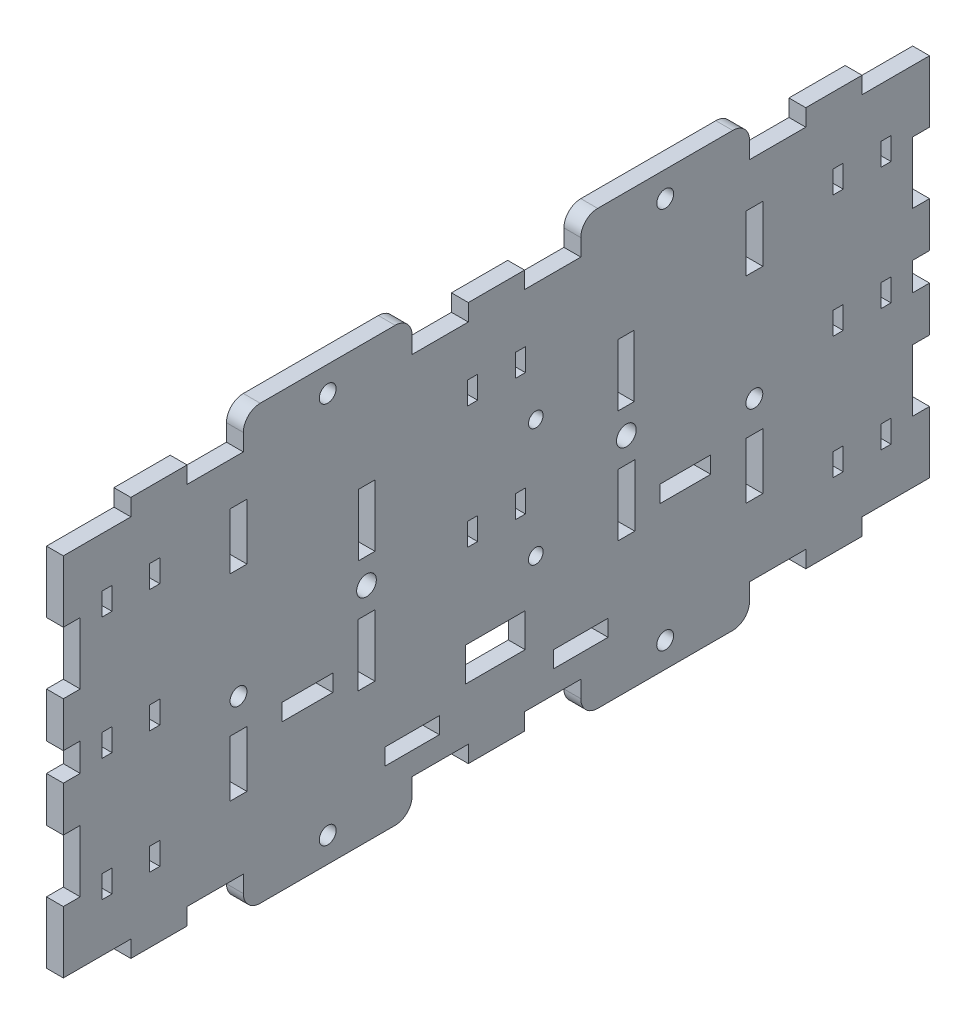
from build123d import *

# Parameters (mm, degrees)
CROQUIS1_W               = 154
CROQUIS1_H               = 71
SALIENTE_EXTRUIR1_DEPTH  = 1.5
CROQUIS2_W               = 12
CROQUIS2_H               = 3
CROQUIS2_W_2             = 10
CROQUIS2_W_3             = 3
CROQUIS2_H_2             = 11
CROQUIS2_H_3             = 5
CORTAR_EXTRUIR1_DEPTH    = 13
CROQUIS4_W               = 30
CROQUIS4_H               = 3
SALIENTE_EXTRUIR3_DEPTH  = 3
REDONDEO2_R              = 3
CROQUIS5_R               = 1.5
CORTAR_EXTRUIR2_DEPTH    = 3
REDONDEO2_OF_SIMETR_A4_R = 3
SIMETR_A5_START          = -1.5
SIMETR_A5_OUTLINE_R      = 1.5
SIMETR_A5_DEPTH          = 3
SIMETR_A5_2_DEPTH        = 3
CROQUIS6_W               = 3
CROQUIS6_H               = 10
CROQUIS6_W_2             = 9.7
CROQUIS6_H_2             = 2.94
CROQUIS6_W_3             = 10.628979849
CROQUIS6_H_3             = 6
CORTAR_EXTRUIR3_DEPTH    = 10
CROQUIS7_R               = 1.5
CORTAR_EXTRUIR4_DEPTH    = 10
CROQUIS8_W               = 9
CROQUIS8_H               = 3
CORTAR_EXTRUIR5_DEPTH    = 10
CROQUIS9_W               = 2.8
CROQUIS9_H               = 14.9
CORTAR_EXTRUIR6_DEPTH    = 10
CROQUIS10_W              = 1.8
CROQUIS10_H              = 4
CORTAR_EXTRUIR7_DEPTH    = 10
CROQUIS11_R              = 1.3
CROQUIS11_R_2            = 1.310434607
CORTAR_EXTRUIR8_DEPTH    = 10
CROQUIS12_W              = 2.9
CROQUIS12_H              = 11
CROQUIS12_W_2            = 3
CORTAR_EXTRUIR9_DEPTH    = 10
CROQUIS13_W              = 3
CROQUIS13_H              = 9
SALIENTE_EXTRUIR4_DEPTH  = 3
CROQUIS14_R              = 1.75
CORTAR_EXTRUIR10_DEPTH   = 3


# Read off the part's stored shape, not the designer's step: Simetría5
with BuildPart() as part:
    # Croquis1 → Saliente-Extruir1 (new, symmetric)
    with BuildSketch(Plane(origin=(0, 0, 0), x_dir=(0, 0, -1), z_dir=(1, 0, 0))):
        Rectangle(CROQUIS1_W, CROQUIS1_H)
    extrude(amount=SALIENTE_EXTRUIR1_DEPTH, both=True)

    # Croquis2 → Cortar-Extruir1 (cut)
    with BuildSketch(Plane(origin=(1.5, 0, 0), x_dir=(0, 0, -1), z_dir=(1, 0, 0))):
        with Locations((-71, 34)):
            Rectangle(CROQUIS2_W, CROQUIS2_H)
        with Locations((-50, 34)):
            Rectangle(CROQUIS2_W_2, CROQUIS2_H)
        with Locations((-10, 34)):
            Rectangle(CROQUIS2_W_2, CROQUIS2_H)
        with Locations((10, 34)):
            Rectangle(CROQUIS2_W_2, CROQUIS2_H)
        with Locations((50, 34)):
            Rectangle(CROQUIS2_W_2, CROQUIS2_H)
        with Locations((71, 34)):
            Rectangle(CROQUIS2_W, CROQUIS2_H)
        with Locations((50, -34)):
            Rectangle(CROQUIS2_W_2, CROQUIS2_H)
        with Locations((10, -34)):
            Rectangle(CROQUIS2_W_2, CROQUIS2_H)
        with Locations((-10, -34)):
            Rectangle(CROQUIS2_W_2, CROQUIS2_H)
        with Locations((-50, -34)):
            Rectangle(CROQUIS2_W_2, CROQUIS2_H)
        with Locations((-71, -34)):
            Rectangle(CROQUIS2_W, CROQUIS2_H)
        with Locations((71, -34)):
            Rectangle(CROQUIS2_W, CROQUIS2_H)
        with Locations((-75.5, -16)):
            Rectangle(CROQUIS2_W_3, CROQUIS2_H_2)
        with Locations((-75.5, 0)):
            Rectangle(CROQUIS2_W_3, CROQUIS2_H_3)
        with Locations((-75.5, 16)):
            Rectangle(CROQUIS2_W_3, CROQUIS2_H_2)
        with Locations((75.5, -16)):
            Rectangle(CROQUIS2_W_3, CROQUIS2_H_2)
        with Locations((75.5, 16)):
            Rectangle(CROQUIS2_W_3, CROQUIS2_H_2)
        with Locations((75.5, 0)):
            Rectangle(CROQUIS2_W_3, CROQUIS2_H_3)
    extrude(amount=-CORTAR_EXTRUIR1_DEPTH, mode=Mode.SUBTRACT)

    # Croquis4 → Saliente-Extruir3 (add)
    with BuildSketch(Plane(origin=(1.5, 0, 0), x_dir=(0, 0, -1), z_dir=(1, 0, 0))):
        with Locations((-30, 37)):
            Rectangle(CROQUIS4_W, CROQUIS4_H)
    saliente_extruir3 = extrude(amount=-SALIENTE_EXTRUIR3_DEPTH)

    # Redondeo2
    redondeo2_edges = [part.edges().sort_by_distance(p)[0] for p in [
        (0, 38.5, 45),
        (0, 38.5, 15),
    ]]
    fillet(redondeo2_edges, radius=REDONDEO2_R)

    # Croquis5 → Cortar-Extruir2 (cut)
    with BuildSketch(Plane(origin=(1.5, 0, 0), x_dir=(0, 0, -1), z_dir=(1, 0, 0))):
        with Locations((-30, 34)):
            Circle(CROQUIS5_R)
    cortar_extruir2 = extrude(amount=-CORTAR_EXTRUIR2_DEPTH, mode=Mode.SUBTRACT)

    # Simetría4: Saliente-Extruir3, Cortar-Extruir2 across plane
    add(saliente_extruir3.mirror(Plane.ZX))
    add(cortar_extruir2.mirror(Plane.ZX), mode=Mode.SUBTRACT)

    # Redondeo2 of Simetría4
    redondeo2_of_simetr_a4_edges = [part.edges().sort_by_distance(p)[0] for p in [
        (0, -38.5, 45),
        (0, -38.5, 15),
    ]]
    fillet(redondeo2_of_simetr_a4_edges, radius=REDONDEO2_OF_SIMETR_A4_R)

    # Simetría5 outline → Simetría5 (cut)
    with BuildSketch(Plane.YZ.offset(SIMETR_A5_START)):
        with Locations((34, -30)):
            Circle(SIMETR_A5_OUTLINE_R)
        with Locations((-34, -30)):
            Circle(SIMETR_A5_OUTLINE_R)
    extrude(amount=SIMETR_A5_DEPTH, mode=Mode.SUBTRACT)

    # Simetr_a5 2 outline → Simetr_a5 2 (add)
    with BuildSketch(Plane.YZ.offset(SIMETR_A5_START)):
        with BuildLine():
            Line((38.5, -42), (38.5, -18))
            ThreePointArc((38.5, -18), (37.621320344, -15.878679656), (35.5, -15))
            Line((35.5, -15), (35.5, -45))
            ThreePointArc((35.5, -45), (37.621320344, -44.121320344), (38.5, -42))
        make_face()
        with BuildLine():
            ThreePointArc((-35.5, -15), (-37.621320344, -15.878679656), (-38.5, -18))
            Line((-38.5, -18), (-38.5, -42))
            ThreePointArc((-38.5, -42), (-37.621320344, -44.121320344), (-35.5, -45))
            Line((-35.5, -45), (-35.5, -15))
        make_face()
    extrude(amount=SIMETR_A5_2_DEPTH)

    # Croquis6 → Cortar-Extruir3 (cut)
    with BuildSketch(Plane.ZY.offset(1.5)):
        with Locations((45.853003866, -15.094545578)):
            Rectangle(CROQUIS6_W, CROQUIS6_H)
        with Locations((45.853003866, 19.905454422)):
            Rectangle(CROQUIS6_W, CROQUIS6_H)
        with Locations((-45.853003866, -15.094545578)):
            Rectangle(CROQUIS6_W, CROQUIS6_H)
        with Locations((-45.853003866, 19.905454422)):
            Rectangle(CROQUIS6_W, CROQUIS6_H)
        with Locations((15, -27)):
            Rectangle(CROQUIS6_W_2, CROQUIS6_H_2)
        with Locations((-15, -27)):
            Rectangle(CROQUIS6_W_2, CROQUIS6_H_2)
        with Locations((0.209178282, -20)):
            Rectangle(CROQUIS6_W_3, CROQUIS6_H_3)
    extrude(amount=-CORTAR_EXTRUIR3_DEPTH, mode=Mode.SUBTRACT)

    # Croquis7 → Cortar-Extruir4 (cut)
    with BuildSketch(Plane(origin=(1.5, 0, 0), x_dir=(0, 0, -1), z_dir=(1, 0, 0))):
        with Locations((-45.853003866, -4.694545578)):
            Circle(CROQUIS7_R)
        with Locations(Location((45.853003866, -4.694545578, 0), (0, 0, 180))):
            Circle(CROQUIS7_R)
    extrude(amount=-CORTAR_EXTRUIR4_DEPTH, mode=Mode.SUBTRACT)

    # Croquis8 → Cortar-Extruir5 (cut)
    with BuildSketch(Plane.ZY.offset(1.5)):
        with Locations((-33.6, -11)):
            Rectangle(CROQUIS8_W, CROQUIS8_H)
        with Locations((33.6, -11)):
            Rectangle(CROQUIS8_W, CROQUIS8_H)
    extrude(amount=-CORTAR_EXTRUIR5_DEPTH, mode=Mode.SUBTRACT)

    # Croquis9 → Cortar-Extruir6 (cut)
    with BuildSketch(Plane.ZY.offset(1.5)):
        with Locations((-23.1, 1)):
            Rectangle(CROQUIS9_W, CROQUIS9_H)
        with Locations((23.1, 1)):
            Rectangle(CROQUIS9_W, CROQUIS9_H)
    extrude(amount=-CORTAR_EXTRUIR6_DEPTH, mode=Mode.SUBTRACT)

    # Croquis10 → Cortar-Extruir7 (cut)
    with BuildSketch(Plane.ZY.offset(1.5)):
        with Locations((-69.25, 21.635)):
            Rectangle(CROQUIS10_W, CROQUIS10_H)
        with Locations((-60.75, 21.635)):
            Rectangle(CROQUIS10_W, CROQUIS10_H)
        with Locations((-69.25, -0.125)):
            Rectangle(CROQUIS10_W, CROQUIS10_H)
        with Locations((-60.75, -0.125)):
            Rectangle(CROQUIS10_W, CROQUIS10_H)
        with Locations((-60.75, -21.885)):
            Rectangle(CROQUIS10_W, CROQUIS10_H)
        with Locations((-69.25, -21.885)):
            Rectangle(CROQUIS10_W, CROQUIS10_H)
        with Locations((-4.25, 21.635)):
            Rectangle(CROQUIS10_W, CROQUIS10_H)
        with Locations((4.25, 21.635)):
            Rectangle(CROQUIS10_W, CROQUIS10_H)
        with Locations((-4.25, -0.125)):
            Rectangle(CROQUIS10_W, CROQUIS10_H)
        with Locations((4.25, -0.125)):
            Rectangle(CROQUIS10_W, CROQUIS10_H)
        with Locations((69.25, -21.885)):
            Rectangle(CROQUIS10_W, CROQUIS10_H)
        with Locations((60.75, -21.885)):
            Rectangle(CROQUIS10_W, CROQUIS10_H)
        with Locations((60.75, -0.125)):
            Rectangle(CROQUIS10_W, CROQUIS10_H)
        with Locations((69.25, -0.125)):
            Rectangle(CROQUIS10_W, CROQUIS10_H)
        with Locations((60.75, 21.635)):
            Rectangle(CROQUIS10_W, CROQUIS10_H)
        with Locations((69.25, 21.635)):
            Rectangle(CROQUIS10_W, CROQUIS10_H)
    extrude(amount=-CORTAR_EXTRUIR7_DEPTH, mode=Mode.SUBTRACT)

    # Croquis11 → Cortar-Extruir8 (cut)
    with BuildSketch(Plane(origin=(1.5, 0, 0), x_dir=(0, 0, -1), z_dir=(1, 0, 0))):
        with Locations((-23, 1)):
            Circle(CROQUIS11_R)
        with Locations((7, 11.5)):
            Circle(CROQUIS11_R)
        with Locations((7, -9.5)):
            Circle(CROQUIS11_R_2)
    extrude(amount=-CORTAR_EXTRUIR8_DEPTH, mode=Mode.SUBTRACT)

    # Croquis12 → Cortar-Extruir9 (cut)
    with BuildSketch(Plane(origin=(1.5, 0, 0), x_dir=(0, 0, -1), z_dir=(1, 0, 0))):
        with Locations((-23.05, 11)):
            Rectangle(CROQUIS12_W, CROQUIS12_H)
        with Locations((-23.1, -9)):
            Rectangle(CROQUIS12_W_2, CROQUIS12_H)
    cortar_extruir9 = extrude(amount=-CORTAR_EXTRUIR9_DEPTH, mode=Mode.SUBTRACT)

    # Croquis13 → Saliente-Extruir4 (add)
    with BuildSketch(Plane(origin=(1.5, 0, 0), x_dir=(0, 0, -1), z_dir=(1, 0, 0))):
        with Locations((-23.1, 1)):
            Rectangle(CROQUIS13_W, CROQUIS13_H)
    saliente_extruir4 = extrude(amount=-SALIENTE_EXTRUIR4_DEPTH)

    # Simetría7: Cortar-Extruir9, Saliente-Extruir4 across plane
    add(cortar_extruir9.mirror(Plane.XY), mode=Mode.SUBTRACT)
    add(saliente_extruir4.mirror(Plane.XY))

    # Croquis14 → Cortar-Extruir10 (cut)
    with BuildSketch(Plane.ZY.offset(1.5)):
        with Locations((-23.1, 1)):
            Circle(CROQUIS14_R)
        with Locations((23.1, 1)):
            Circle(CROQUIS14_R)
    extrude(amount=-CORTAR_EXTRUIR10_DEPTH, mode=Mode.SUBTRACT)


solid = part.part
